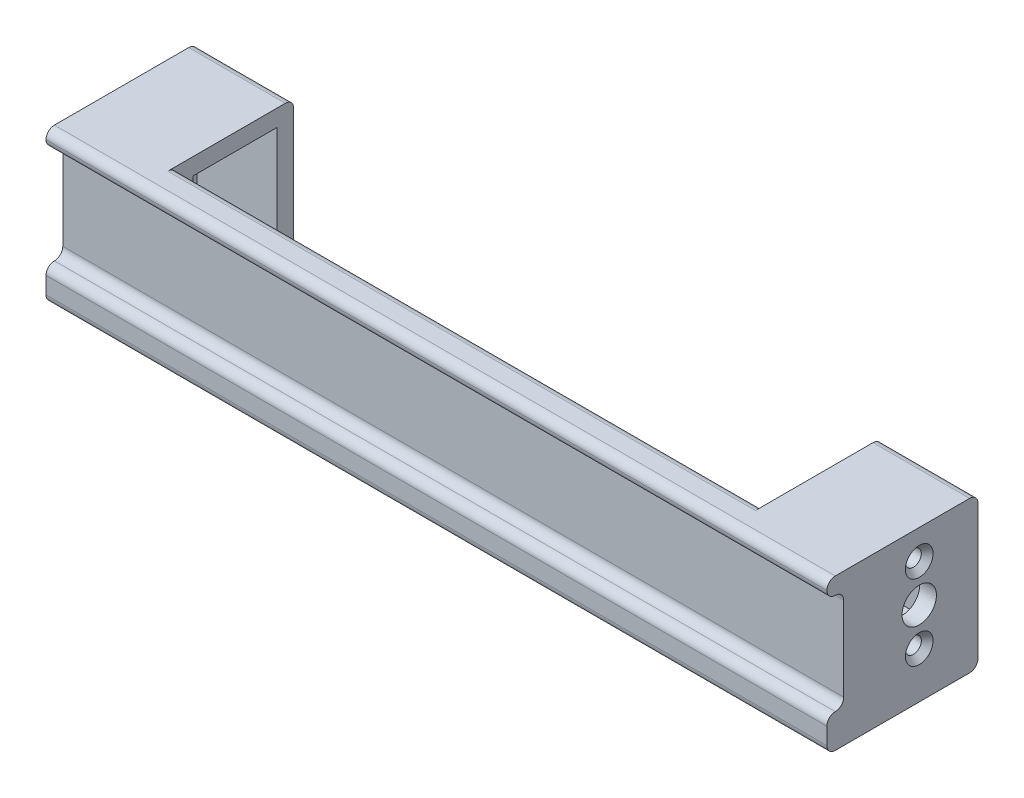
from build123d import *

# Parameters (mm, degrees)
BOSS_EXTRUDE1_DEPTH = 2
SKETCH2_5_W         = 11.5
SKETCH2_5_H         = 14
BOSS_EXTRUDE3_DEPTH = 18
SKETCH3_R           = 2.05
SKETCH3_R_2         = 0.95
CUT_EXTRUDE2_DEPTH  = 96.754895436
CUT_EXTRUDE3_START  = -9.5
SKETCH5_W           = 10.007299984
SKETCH5_H           = 12.005127567
SKETCH5_R           = 0.95
SKETCH5_R_2         = 2.05
CUT_EXTRUDE3_DEPTH  = 9.5
SKETCH6_W           = 10
SKETCH6_H           = 12
SKETCH6_R           = 0.95
SKETCH6_R_2         = 2.05
CUT_EXTRUDE4_DEPTH  = 9.5
CHAMFER1_SIZE       = 0.7
SKETCH11_W          = 2
SKETCH11_H          = 18
BOSS_EXTRUDE6_DEPTH = 93
SKETCH12_W          = 93
SKETCH12_H          = 4
SKETCH12_H_2        = 2
BOSS_EXTRUDE7_DEPTH = 2
SKETCH14_W          = 70
SKETCH14_H          = 14
CUT_EXTRUDE6_DEPTH  = 2
SKETCH16_W          = 70
SKETCH16_H          = 3
CUT_EXTRUDE7_DEPTH  = 2
SKETCH17_W          = 16
SKETCH17_H          = 3
CUT_EXTRUDE8_DEPTH  = 2
SKETCH18_W          = 16
SKETCH18_H          = 3
CUT_EXTRUDE9_DEPTH  = 2
FILLET4_R           = 1


with BuildPart() as part:
    # Sketch2 → Boss-Extrude1 (new body)
    with BuildSketch(Plane(origin=(0, 0, 0), x_dir=(1, 0, 0), z_dir=(0, 1, 0))):
        Polygon((-11.5, 0), (-81.5, 0), (-93, 0), (-93, 14), (-81.5, 14), (-11.5, 14), (0, 14), (0, 0), align=None)
    extrude(amount=BOSS_EXTRUDE1_DEPTH)

    # Sketch2<5> → Boss-Extrude3 (add)
    with BuildSketch(Plane(origin=(0, 0, 0), x_dir=(1, 0, 0), z_dir=(0, 1, 0))):
        with Locations((-87.25, 7)):
            Rectangle(SKETCH2_5_W, SKETCH2_5_H)
        with Locations((-5.75, 7)):
            Rectangle(SKETCH2_5_W, SKETCH2_5_H)
    extrude(amount=BOSS_EXTRUDE3_DEPTH)

    # Sketch3 → Cut-Extrude2 (cut, through all)
    with BuildSketch(Plane.ZY.offset(93)):
        with Locations((-7, 10)):
            Circle(SKETCH3_R)
        with Locations((-7, 14.5)):
            Circle(SKETCH3_R_2)
        with Locations((-7, 5.5)):
            Circle(SKETCH3_R_2)
    extrude(amount=-CUT_EXTRUDE2_DEPTH, mode=Mode.SUBTRACT)

    # Sketch5 → Cut-Extrude3 (cut)
    with BuildSketch(Plane(origin=(-81.5, 0, 0), x_dir=(0, 0, -1), z_dir=(1, 0, 0)).offset(CUT_EXTRUDE3_START)):
        with Locations((6.99901027, 9.998913792)):
            Rectangle(SKETCH5_W, SKETCH5_H)
        with Locations(Location((7, 14.5, 0), (0, 0, 180))):
            Circle(SKETCH5_R, mode=Mode.SUBTRACT)
        with Locations(Location((7, 5.5, 0), (0, 0, 180))):
            Circle(SKETCH5_R, mode=Mode.SUBTRACT)
        with Locations(Location((7, 10, 0), (0, 0, 180))):
            Circle(SKETCH5_R_2, mode=Mode.SUBTRACT)
    extrude(amount=CUT_EXTRUDE3_DEPTH, mode=Mode.SUBTRACT)

    # Sketch6 → Cut-Extrude4 (cut)
    with BuildSketch(Plane.ZY.offset(11.5)):
        with Locations((-7.002660262, 9.996350008)):
            Rectangle(SKETCH6_W, SKETCH6_H)
        with Locations((-7, 14.5)):
            Circle(SKETCH6_R, mode=Mode.SUBTRACT)
        with Locations((-7, 5.5)):
            Circle(SKETCH6_R, mode=Mode.SUBTRACT)
        with Locations((-7, 10)):
            Circle(SKETCH6_R_2, mode=Mode.SUBTRACT)
    extrude(amount=-CUT_EXTRUDE4_DEPTH, mode=Mode.SUBTRACT)

    # Chamfer1
    chamfer1_edges = [part.edges().sort_by_distance(p)[0] for p in [
        (0, 14.5, -7.95),
        (-93, 14.5, -7.95),
        (0, 5.5, -7.95),
        (-93, 5.5, -7.95),
    ]]
    chamfer(chamfer1_edges, length=CHAMFER1_SIZE)

    # Sketch11 → Boss-Extrude6 (add)
    with BuildSketch(Plane(origin=(0, 0, 0), x_dir=(0, 0, -1), z_dir=(1, 0, 0))):
        with Locations((-1, 9)):
            Rectangle(SKETCH11_W, SKETCH11_H)
    extrude(amount=-BOSS_EXTRUDE6_DEPTH)

    # Sketch12 → Boss-Extrude7 (add)
    with BuildSketch(Plane.XY.offset(2)):
        with Locations((-46.5, 2)):
            Rectangle(SKETCH12_W, SKETCH12_H)
        with Locations((-46.5, 17)):
            Rectangle(SKETCH12_W, SKETCH12_H_2)
    extrude(amount=BOSS_EXTRUDE7_DEPTH)

    # Sketch14 → Cut-Extrude6 (cut)
    with BuildSketch(Plane(origin=(0, 2, 0), x_dir=(1, 0, 0), z_dir=(0, 1, 0))):
        with Locations((-46.5, 7)):
            Rectangle(SKETCH14_W, SKETCH14_H)
    extrude(amount=-CUT_EXTRUDE6_DEPTH, mode=Mode.SUBTRACT)

    # Sketch16 → Cut-Extrude7 (cut)
    with BuildSketch(Plane(origin=(0, 0, 0), x_dir=(-1, 0, 0), z_dir=(0, 0, -1))):
        with Locations((46.5, 2)):
            Rectangle(SKETCH16_W, SKETCH16_H)
    extrude(amount=-CUT_EXTRUDE7_DEPTH, mode=Mode.SUBTRACT)

    # Sketch17 → Cut-Extrude8 (cut)
    with BuildSketch(Plane(origin=(-81.5, 0, 0), x_dir=(0, 0, -1), z_dir=(1, 0, 0))):
        with Locations((6, 2)):
            Rectangle(SKETCH17_W, SKETCH17_H)
    extrude(amount=-CUT_EXTRUDE8_DEPTH, mode=Mode.SUBTRACT)

    # Sketch18 → Cut-Extrude9 (cut)
    with BuildSketch(Plane.ZY.offset(11.5)):
        with Locations((-6, 2)):
            Rectangle(SKETCH18_W, SKETCH18_H)
    extrude(amount=-CUT_EXTRUDE9_DEPTH, mode=Mode.SUBTRACT)

    # Fillet4
    fillet4_edges = [part.edges().sort_by_distance(p)[0] for p in [
        (-46.5, 18, 0),
        (-46.5, 4, 2),
        (-46.5, 0, 4),
        (-46.5, 4, 4),
        (-46.5, 16, 2),
        (-46.5, 18, 4),
        (-87.25, 0, -14),
        (-87.25, 18, -14),
        (-5.75, 18, -14),
        (-5.75, 0, -14),
        (-46.5, 16, 4),
    ]]
    fillet(fillet4_edges, radius=FILLET4_R - 0.0001)  # a hair under: the kernel refuses the full size


solid = part.part
